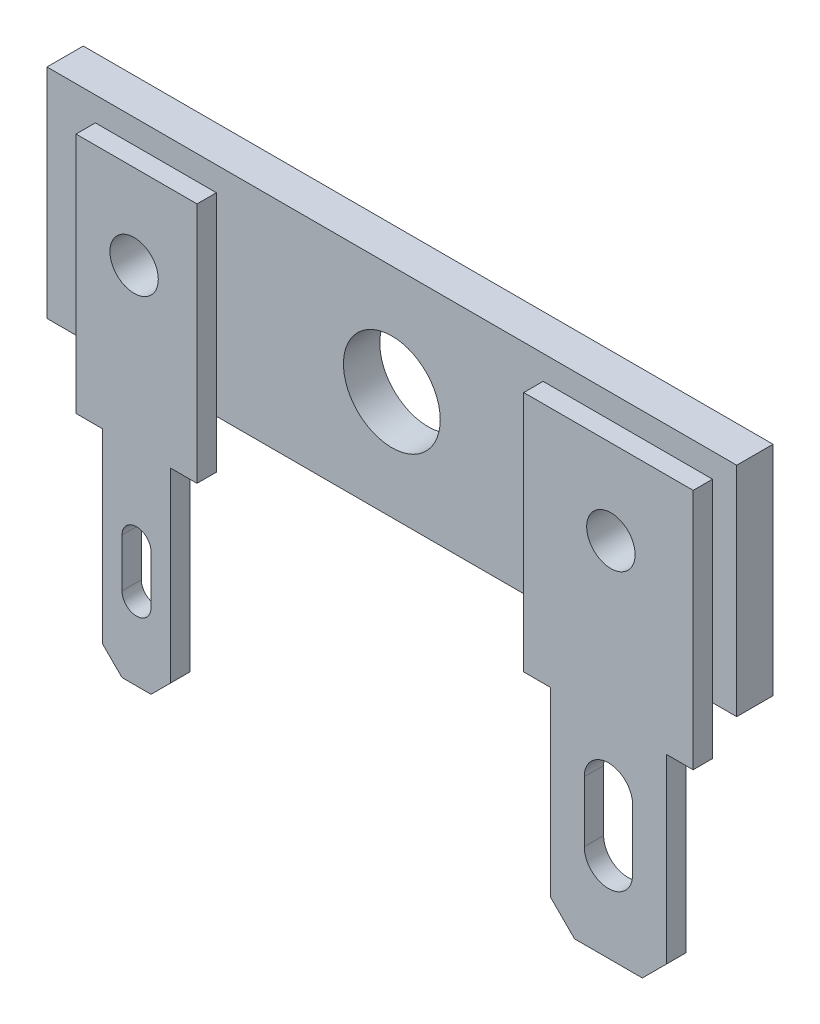
from build123d import *
from build123d.topology import SkipClean

# Parameters (mm, degrees)
ESQUISSE1_W             = 7
ESQUISSE1_H             = 8
ESQUISSE1_W_2           = 5
BOSS_EXTRU_1_DEPTH      = 1.5
ESQUISSE2_R             = 1
BOSS_EXTRU_2_DEPTH      = 0.8
ESQUISSE3_W             = 1.5
ESQUISSE3_H             = 10.5
ENL_V_MAT_EXTRU_1_DEPTH = 28.5


with BuildPart() as part:
    # Esquisse1 → Boss.-Extru.1 (new body)
    # profile 1 of 5: a face of its own
    with BuildSketch(Plane.XY):
        Polygon((-54.543024121, 30.316995205), (-54.543024121, 22.316995205), (-53.543024121, 22.316995205), (-53.543024121, 31.316995205), (-82.043024121, 31.316995205), (-82.043024121, 22.316995205), (-80.043024121, 22.316995205), (-80.043024121, 30.316995205), (-75.043024121, 30.316995205), (-75.043024121, 22.316995205), (-61.543024121, 22.316995205), (-61.543024121, 30.316995205), align=None)
        with BuildLine():
            ThreePointArc((-69.793024121, 26.816995205), (-67.793024121, 28.816995205), (-65.793024121, 26.816995205))
            ThreePointArc((-65.793024121, 26.816995205), (-67.793024121, 24.816995205), (-69.793024121, 26.816995205))
        make_face(mode=Mode.SUBTRACT)
    # profile 2 of 5: a face of its own
    with BuildSketch(Plane.XY):
        Polygon((-55.643024121, 20.316995205), (-54.543024121, 20.316995205), (-54.543024121, 22.316995205), (-61.543024121, 22.316995205), (-61.543024121, 20.316995205), (-60.443024121, 20.316995205), (-60.443024121, 12.816995205), (-59.443024121, 11.816995205), (-56.643024121, 11.816995205), (-55.643024121, 12.816995205), align=None)
        with BuildLine():
            ThreePointArc((-59.043024121, 17.816995205), (-58.043024121, 18.816995205), (-57.043024121, 17.816995205))
            Line((-57.043024121, 17.816995205), (-57.043024121, 15.316995205))
            ThreePointArc((-57.043024121, 15.316995205), (-58.043024121, 14.316995205), (-59.043024121, 15.316995205))
            Line((-59.043024121, 15.316995205), (-59.043024121, 17.816995205))
        make_face(mode=Mode.SUBTRACT)
    # profile 3 of 5: a face of its own
    with BuildSketch(Plane.XY):
        Polygon((-75.043024121, 20.316995205), (-75.043024121, 22.316995205), (-80.043024121, 22.316995205), (-80.043024121, 20.316995205), (-78.943024121, 20.316995205), (-78.943024121, 12.616995205), (-78.143024121, 11.816995205), (-76.943024121, 11.816995205), (-76.143024121, 12.616995205), (-76.143024121, 20.316995205), align=None)
        with BuildLine():
            ThreePointArc((-78.143024121, 16.916995205), (-77.543024121, 17.516995205), (-76.943024121, 16.916995205))
            Line((-76.943024121, 16.916995205), (-76.943024121, 14.916995205))
            ThreePointArc((-76.943024121, 14.916995205), (-77.543024121, 14.316995205), (-78.143024121, 14.916995205))
            Line((-78.143024121, 14.916995205), (-78.143024121, 16.916995205))
        make_face(mode=Mode.SUBTRACT)
    # profile 4 of 5: a face of its own
    with BuildSketch(Plane.XY):
        with Locations((-58.043024121, 26.316995205)):
            Rectangle(ESQUISSE1_W, ESQUISSE1_H)
        with BuildLine():
            ThreePointArc((-58.943024121, 26.816995205), (-57.943024121, 27.816995205), (-56.943024121, 26.816995205))
            ThreePointArc((-56.943024121, 26.816995205), (-57.943024121, 25.816995205), (-58.943024121, 26.816995205))
        make_face(mode=Mode.SUBTRACT)
    # profile 5 of 5: a face of its own
    with BuildSketch(Plane.XY):
        with Locations((-77.543024121, 26.316995205)):
            Rectangle(ESQUISSE1_W_2, ESQUISSE1_H)
        with BuildLine():
            ThreePointArc((-76.643024121, 26.816995205), (-77.643024121, 25.816995205), (-78.643024121, 26.816995205))
            ThreePointArc((-78.643024121, 26.816995205), (-77.643024121, 27.816995205), (-76.643024121, 26.816995205))
        make_face(mode=Mode.SUBTRACT)
    extrude(amount=BOSS_EXTRU_1_DEPTH)

    # Esquisse2 → Boss.-Extru.2 (add)
    # profile 1 of 2: a face of its own
    with SkipClean():  # the faces are left unmerged after this step: merging them gives an invalid solid
        with BuildSketch(Plane.XY.offset(1.5)):
            Polygon((-80.043024121, 22.316995205), (-80.043024121, 20.316995205), (-78.943024121, 20.316995205), (-78.943024121, 12.616995205), (-78.143024121, 11.816995205), (-76.943024121, 11.816995205), (-76.143024121, 12.616995205), (-76.143024121, 20.316995205), (-75.043024121, 20.316995205), (-75.043024121, 22.316995205), (-75.043024121, 30.316995205), (-80.043024121, 30.316995205), align=None)
            with BuildLine():
                ThreePointArc((-78.143024121, 16.916995205), (-77.543024121, 17.516995205), (-76.943024121, 16.916995205))
                Line((-76.943024121, 16.916995205), (-76.943024121, 14.916995205))
                ThreePointArc((-76.943024121, 14.916995205), (-77.543024121, 14.316995205), (-78.143024121, 14.916995205))
                Line((-78.143024121, 14.916995205), (-78.143024121, 16.916995205))
            make_face(mode=Mode.SUBTRACT)
            with Locations((-77.643024121, 26.816995205)):
                Circle(ESQUISSE2_R, mode=Mode.SUBTRACT)
        # profile 2 of 2: a face of its own
        with BuildSketch(Plane.XY.offset(1.5)):
            Polygon((-61.543024121, 22.316995205), (-61.543024121, 20.316995205), (-60.443024121, 20.316995205), (-60.443024121, 12.816995205), (-59.443024121, 11.816995205), (-56.643024121, 11.816995205), (-55.643024121, 12.816995205), (-55.643024121, 20.316995205), (-54.543024121, 20.316995205), (-54.543024121, 22.316995205), (-54.543024121, 30.316995205), (-61.543024121, 30.316995205), align=None)
            with BuildLine():
                ThreePointArc((-59.043024121, 17.816995205), (-58.043024121, 18.816995205), (-57.043024121, 17.816995205))
                Line((-57.043024121, 17.816995205), (-57.043024121, 15.316995205))
                ThreePointArc((-57.043024121, 15.316995205), (-58.043024121, 14.316995205), (-59.043024121, 15.316995205))
                Line((-59.043024121, 15.316995205), (-59.043024121, 17.816995205))
            make_face(mode=Mode.SUBTRACT)
            with Locations((-57.943024121, 26.816995205)):
                Circle(ESQUISSE2_R, mode=Mode.SUBTRACT)
        extrude(amount=BOSS_EXTRU_2_DEPTH)

    # Esquisse3 → Enlèv. mat.-Extru.1 (cut)
    with SkipClean():  # the faces are left unmerged after this step: merging them gives an invalid solid
        with BuildSketch(Plane.ZY.offset(82.043024121)):
            with Locations((0.75, 17.066995205)):
                Rectangle(ESQUISSE3_W, ESQUISSE3_H)
        extrude(amount=-ENL_V_MAT_EXTRU_1_DEPTH, mode=Mode.SUBTRACT)
    add(part.part.scale(1), mode=Mode.REPLACE)  # the faces are merged on a copy


solid = part.part
